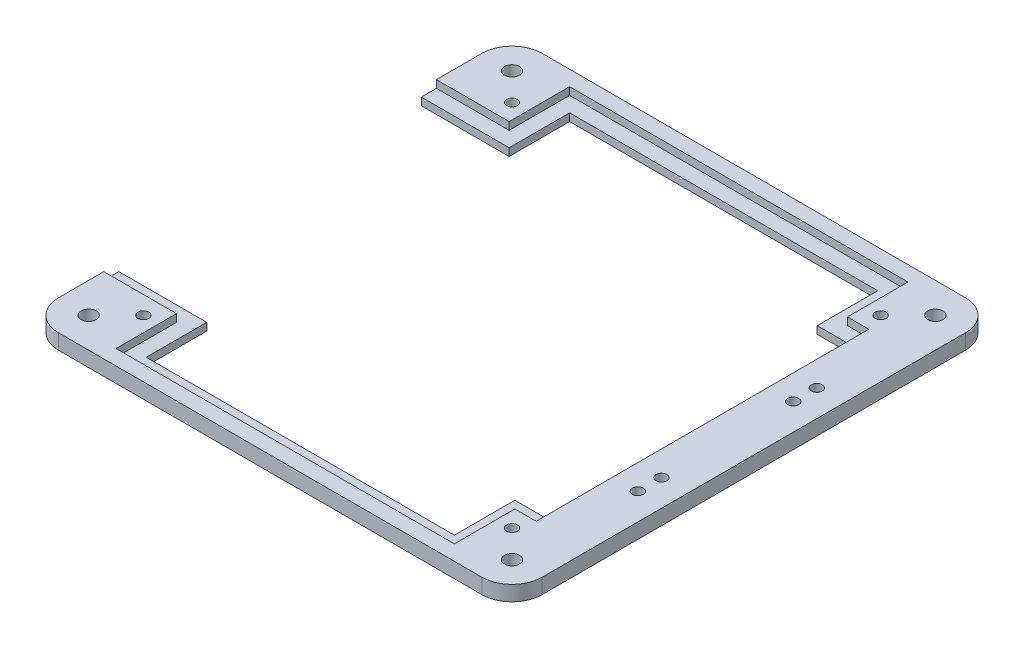
from build123d import *

# Parameters (mm, degrees)
BOSS_EXTRUDE2_DEPTH = 6.35
SKETCH2_R           = 3.175
CUT_EXTRUDE1_DEPTH  = 262.894200967
SKETCH7_R           = 2.286
CUT_EXTRUDE3_DEPTH  = 12.7
SKETCH8_R           = 2.286
CUT_EXTRUDE4_DEPTH  = 262.894200967
SKETCH9_W           = 129.404437756
SKETCH9_H           = 25.4
CUT_EXTRUDE5_DEPTH  = 262.894200967
CUT_EXTRUDE6_DEPTH  = 3.175


with BuildPart() as part:
    # Sketch1 → Boss-Extrude2 (new body)
    with BuildSketch(Plane(origin=(0, 0, 0), x_dir=(1, 0, 0), z_dir=(0, 1, 0))):
        with BuildLine():
            Line((0, 0), (0, 25.4))
            ThreePointArc((0, 25.4), (3.719743879, 34.380256121), (12.7, 38.1))
            Line((12.7, 38.1), (190.5, 38.1))
            ThreePointArc((190.5, 38.1), (199.480256121, 34.380256121), (203.2, 25.4))
            Line((203.2, 25.4), (203.2, -152.4))
            ThreePointArc((203.2, -152.4), (199.480256121, -161.380256121), (190.5, -165.1))
            Line((190.5, -165.1), (12.7, -165.1))
            ThreePointArc((12.7, -165.1), (3.719743879, -161.380256121), (0, -152.4))
            Line((0, -152.4), (0, -127))
            Line((0, -127), (181.61, -127))
            Line((181.61, -127), (181.61, 0))
            Line((181.61, 0), (0, 0))
        make_face()
    extrude(amount=BOSS_EXTRUDE2_DEPTH)

    # Sketch2 → Cut-Extrude1 (cut, through all)
    with BuildSketch(Plane(origin=(0, 6.35, 0), x_dir=(1, 0, 0), z_dir=(0, 1, 0))):
        with Locations((12.7, 25.4)):
            Circle(SKETCH2_R)
        with Locations((190.5, 25.4)):
            Circle(SKETCH2_R)
        with Locations((190.5, -152.4)):
            Circle(SKETCH2_R)
        with Locations((12.7, -152.4)):
            Circle(SKETCH2_R)
    extrude(amount=-CUT_EXTRUDE1_DEPTH, mode=Mode.SUBTRACT)

    # Sketch7 → Cut-Extrude3 (cut)
    with BuildSketch(Plane(origin=(0, 6.35, 0), x_dir=(1, 0, 0), z_dir=(0, 1, 0))):
        with Locations((192.024, -101.092)):
            Circle(SKETCH7_R)
        with Locations((192.024, -91.186)):
            Circle(SKETCH7_R)
        with Locations((192.024, -35.814)):
            Circle(SKETCH7_R)
        with Locations((192.024, -25.908)):
            Circle(SKETCH7_R)
    extrude(amount=-CUT_EXTRUDE3_DEPTH, mode=Mode.SUBTRACT)

    # Sketch8 → Cut-Extrude4 (cut, through all)
    with BuildSketch(Plane(origin=(0, 0, 0), x_dir=(-1, 0, 0), z_dir=(0, -1, 0))):
        with Locations((-24.197781122, 13.902218878)):
            Circle(SKETCH8_R)
        with Locations((-24.197781122, -140.902218878)):
            Circle(SKETCH8_R)
        with Locations((-179.002218878, -140.902218878)):
            Circle(SKETCH8_R)
        with Locations((-179.002218878, 13.902218878)):
            Circle(SKETCH8_R)
    extrude(amount=-CUT_EXTRUDE4_DEPTH, mode=Mode.SUBTRACT)

    # Sketch9 → Cut-Extrude5 (cut, through all)
    with BuildSketch(Plane(origin=(0, 6.35, 0), x_dir=(1, 0, 0), z_dir=(0, 1, 0))):
        with Locations((101.6, 12.7)):
            Rectangle(SKETCH9_W, SKETCH9_H)
        with Locations((101.6, -139.7)):
            Rectangle(SKETCH9_W, SKETCH9_H)
    extrude(amount=-CUT_EXTRUDE5_DEPTH, mode=Mode.SUBTRACT)

    # Sketch10 → Cut-Extrude6 (cut)
    with BuildSketch(Plane(origin=(0, 6.35, 0), x_dir=(1, 0, 0), z_dir=(0, 1, 0))):
        Polygon((0, 6.35), (30.547781122, 6.35), (30.547781122, 31.75), (172.652218878, 31.75), (172.652218878, 6.35), (181.61, 6.35), (181.61, 0), (166.302218878, 0), (166.302218878, 25.4), (36.897781122, 25.4), (36.897781122, 0), (0, 0), align=None)
        Polygon((0, -127), (0, -133.35), (30.547781122, -133.35), (30.547781122, -158.75), (172.652218878, -158.75), (172.652218878, -133.35), (181.61, -133.35), (181.61, -127), (166.302218878, -127), (166.302218878, -152.4), (36.897781122, -152.4), (36.897781122, -127), align=None)
    extrude(amount=-CUT_EXTRUDE6_DEPTH, mode=Mode.SUBTRACT)


solid = part.part
